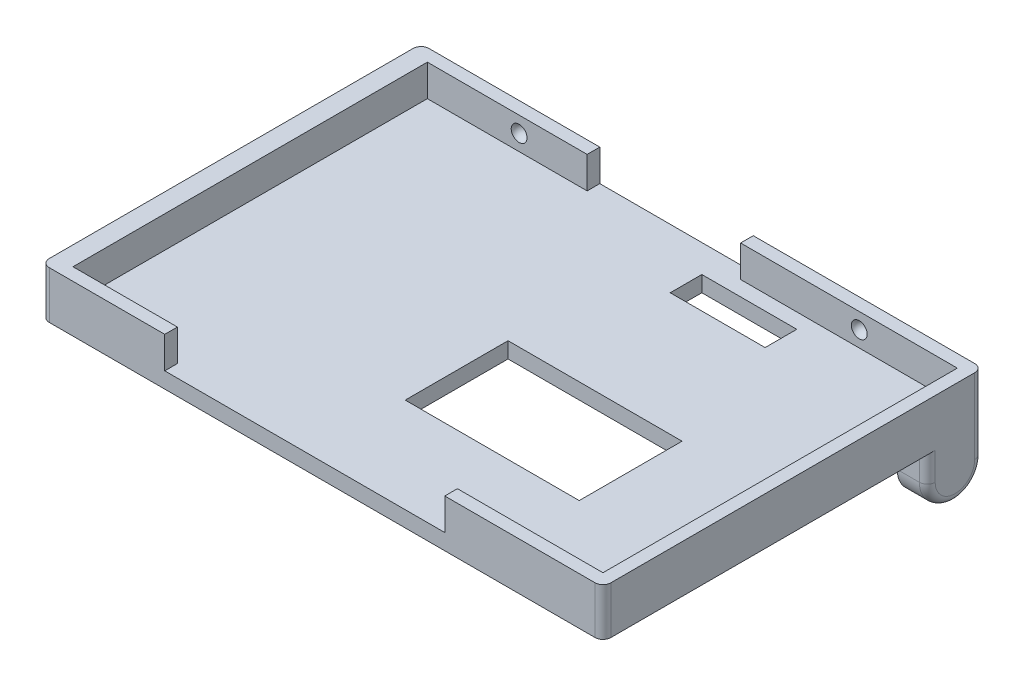
from build123d import *

# Parameters (mm, degrees)
SKETCH_1_W               = 35.5
SKETCH_1_H               = 24
EXTRUDE_1_DEPTH          = 3
SKETCH_2_W               = 31.5
SKETCH_2_H               = 20
CUT_EXTRUDE_1_DEPTH      = 2
SKETCH_4_W               = 1.9
SKETCH_4_H               = 3.5
EXTRUDE_2_DEPTH          = 3.5
CUT_EXTRUDE_3_DEPTH      = 2
CUT_EXTRUDE_4_DEPTH      = 2
CUT_EXTRUDE_START        = -2
CUT_EXTRUDE_5_DEPTH      = 2
CUT_EXTRUDE_6_DEPTH      = 2
SKETCH_10_R              = 0.6
CUT_EXTRUDE_8_DEPTH      = 1.5
SKETCH_11_W              = 6
SKETCH_11_H              = 2
CUT_EXTRUDE_9_DEPTH      = 2
CUT_EXTRUDE_START_2      = -1.5
SKETCH_12_R              = 0.6
CUT_EXTRUDE_10_DEPTH     = 1.5
CUT_EXTRUDE_11_DEPTH     = 2
PATTERN_CIRCULAR_3_COUNT = 8
SKETCH_17_W              = 9.7
SKETCH_17_H              = 0.8
CUT_EXTRUDE_12_DEPTH     = 2
SKETCH_18_W              = 17.7
SKETCH_18_H              = 0.8
CUT_EXTRUDE_13_DEPTH     = 2
SKETCH_19_W              = 11
SKETCH_19_H              = 6.5
CUT_EXTRUDE_14_DEPTH     = 1
FILLET_1_R               = 0.5


with BuildPart() as part:
    # 草图1 → 凸台-拉伸1 (new body)
    with BuildSketch(Plane(origin=(0, 0, 0), x_dir=(1, 0, 0), z_dir=(0, 1, 0))):
        Rectangle(SKETCH_1_W, SKETCH_1_H)
    extrude(amount=EXTRUDE_1_DEPTH)

    # 草图2 → 切除-拉伸1 (cut)
    with BuildSketch(Plane(origin=(0, 3, 0), x_dir=(1, 0, 0), z_dir=(0, 1, 0))):
        Rectangle(SKETCH_2_W, SKETCH_2_H)
    extrude(amount=-CUT_EXTRUDE_1_DEPTH, mode=Mode.SUBTRACT)

    # 草图4 → 凸台-拉伸2 (add)
    with BuildSketch(Plane.XZ):
        with Locations((-16.8, -10.25)):
            Rectangle(SKETCH_4_W, SKETCH_4_H)
        with Locations((16.8, -10.25)):
            Rectangle(SKETCH_4_W, SKETCH_4_H)
    extrude(amount=EXTRUDE_2_DEPTH)

    # 草图5 → 切除-拉伸3 (cut)
    with BuildSketch(Plane.ZY.offset(17.75)):
        with BuildLine():
            Line((-12, -1.75), (-12, -3.5))
            Line((-12, -3.5), (-10.25, -3.5))
            ThreePointArc((-10.25, -3.5), (-11.487436867, -2.987436867), (-12, -1.75))
        make_face()
    extrude(amount=-CUT_EXTRUDE_3_DEPTH, mode=Mode.SUBTRACT)

    # 草图6 → 切除-拉伸4 (cut)
    with BuildSketch(Plane.ZY.offset(17.75)):
        with BuildLine():
            Line((-8.5, -3.5), (-10.25, -3.5))
            ThreePointArc((-10.25, -3.5), (-9.012563133, -2.987436867), (-8.5, -1.75))
            Line((-8.5, -1.75), (-8.5, -3.5))
        make_face()
    extrude(amount=-CUT_EXTRUDE_4_DEPTH, mode=Mode.SUBTRACT)

    # 草图7 → 切除-拉伸5 (cut)
    with BuildSketch(Plane(origin=(17.75, 0, 0), x_dir=(0, 0, -1), z_dir=(1, 0, 0)).offset(CUT_EXTRUDE_START)):
        with BuildLine():
            Line((8.5, -3.5), (10.25, -3.5))
            ThreePointArc((10.25, -3.5), (9.012563133, -2.987436867), (8.5, -1.75))
            Line((8.5, -1.75), (8.5, -3.5))
        make_face()
    extrude(amount=CUT_EXTRUDE_5_DEPTH, mode=Mode.SUBTRACT)

    # 草图8 → 切除-拉伸6 (cut)
    with BuildSketch(Plane(origin=(17.75, 0, 0), x_dir=(0, 0, -1), z_dir=(1, 0, 0)).offset(CUT_EXTRUDE_START)):
        with BuildLine():
            Line((12, -3.5), (10.25, -3.5))
            ThreePointArc((10.25, -3.5), (11.487436867, -2.987436867), (12, -1.75))
            Line((12, -1.75), (12, -3.5))
        make_face()
    extrude(amount=CUT_EXTRUDE_6_DEPTH, mode=Mode.SUBTRACT)

    # 草图10 → 切除-拉伸8 (cut)
    with BuildSketch(Plane.ZY.offset(-15.85)):
        with Locations((-10.25, -1.75)):
            Circle(SKETCH_10_R)
    extrude(amount=-CUT_EXTRUDE_8_DEPTH, mode=Mode.SUBTRACT)

    # 草图11 → 切除-拉伸9 (cut)
    with BuildSketch(Plane.XZ):
        with Locations((4.75, -9.25)):
            Rectangle(SKETCH_11_W, SKETCH_11_H)
    extrude(amount=-CUT_EXTRUDE_9_DEPTH, mode=Mode.SUBTRACT)

    # 草图12 → 切除-拉伸10 (cut)
    with BuildSketch(Plane(origin=(-15.85, 0, 0), x_dir=(0, 0, -1), z_dir=(1, 0, 0)).offset(CUT_EXTRUDE_START_2)):
        with Locations((10.25, -1.75)):
            Circle(SKETCH_12_R)
    extrude(amount=CUT_EXTRUDE_10_DEPTH, mode=Mode.SUBTRACT)

    # 草图13 → 切除-拉伸11 (cut)
    with BuildSketch(Plane(origin=(0, 3, 0), x_dir=(1, 0, 0), z_dir=(0, 1, 0))):
        Polygon((-15.678194125, 11.2), (16.95, 11.2), (16.95, -11.2), (-15.75, -11.2), (-16.55, -11.2), (-16.55, 11.2), align=None)
    extrude(amount=-CUT_EXTRUDE_11_DEPTH, mode=Mode.SUBTRACT)

    # 草图14 → 切除-旋转1 (revolve, cut)
    with BuildSketch(Plane.XY.offset(-11.2)):
        with BuildLine():
            Line((-11.25, 2), (-10.25, 2))
            ThreePointArc((-10.25, 2), (-10.75, 2.5), (-11.25, 2))
        make_face()
        with BuildLine():
            Line((10.25, 2), (11.25, 2))
            ThreePointArc((11.25, 2), (10.75, 2.5), (10.25, 2))
        make_face()
    revolve(axis=Axis((10.25, 2, -11.2), (1, 0, 0)), mode=Mode.SUBTRACT)

    # 草图15 → 切除-旋转2 (revolve, cut)
    with BuildSketch(Plane(origin=(0, 0, 11.2), x_dir=(-1, 0, 0), z_dir=(0, 0, -1))):
        with BuildLine():
            Line((10.25, 2), (11.25, 2))
            ThreePointArc((11.25, 2), (10.75, 2.5), (10.25, 2))
        make_face()
        with BuildLine():
            Line((-11.25, 2), (-10.25, 2))
            ThreePointArc((-10.25, 2), (-10.75, 2.5), (-11.25, 2))
        make_face()
    revolve(axis=Axis((11.25, 2, 11.2), (-1, 0, 0)), mode=Mode.SUBTRACT)

    # 草图16 → 切除-旋转3 (revolve, cut)
    with BuildSketch(Plane.ZY.offset(-15.85)):
        with BuildLine():
            Line((-10.5, -0.5), (-10, -0.5))
            ThreePointArc((-10, -0.5), (-10.25, -0.25), (-10.5, -0.5))
        make_face()
    cut_revolve_3 = revolve(axis=Axis((15.85, -0.5, -10.5), (0, 0, 1)), mode=Mode.SUBTRACT)

    # 阵列(圆周)3: 切除-旋转3 ×8 about axis
    pattern_circular_3_axis = Axis((17.35, -1.75, -10.25), (-1, 0, 0))
    for i in range(1, PATTERN_CIRCULAR_3_COUNT):
        add(cut_revolve_3.rotate(pattern_circular_3_axis, i * 360 / PATTERN_CIRCULAR_3_COUNT), mode=Mode.SUBTRACT)

    # 草图17 → 切除-拉伸12 (cut)
    with BuildSketch(Plane(origin=(0, 3, 0), x_dir=(1, 0, 0), z_dir=(0, 1, 0))):
        with Locations((-1.6, 11.6)):
            Rectangle(SKETCH_17_W, SKETCH_17_H)
    extrude(amount=-CUT_EXTRUDE_12_DEPTH, mode=Mode.SUBTRACT)

    # 草图18 → 切除-拉伸13 (cut)
    with BuildSketch(Plane(origin=(0, 3, 0), x_dir=(1, 0, 0), z_dir=(0, 1, 0))):
        with Locations((-1.1, -11.6)):
            Rectangle(SKETCH_18_W, SKETCH_18_H)
    extrude(amount=-CUT_EXTRUDE_13_DEPTH, mode=Mode.SUBTRACT)

    # 草图19 → 切除-拉伸14 (cut)
    with BuildSketch(Plane.XZ):
        with Locations((4.75, 2.75)):
            Rectangle(SKETCH_19_W, SKETCH_19_H)
    extrude(amount=-CUT_EXTRUDE_14_DEPTH, mode=Mode.SUBTRACT)

    # 圆角1
    fillet_1_edges = [part.edges().sort_by_distance(p)[0] for p in [
        (17.75, -0.875, -8.5),
        (17.75, -3.5, -10.25),
        (-17.75, -0.875, -8.5),
        (-17.75, -3.5, -10.25),
        (17.75, 1.5, 12),
        (17.75, 0.625, -12),
        (-17.75, 0.625, -12),
        (-17.75, 1.5, 12),
    ]]
    fillet(fillet_1_edges, radius=FILLET_1_R)


solid = part.part
